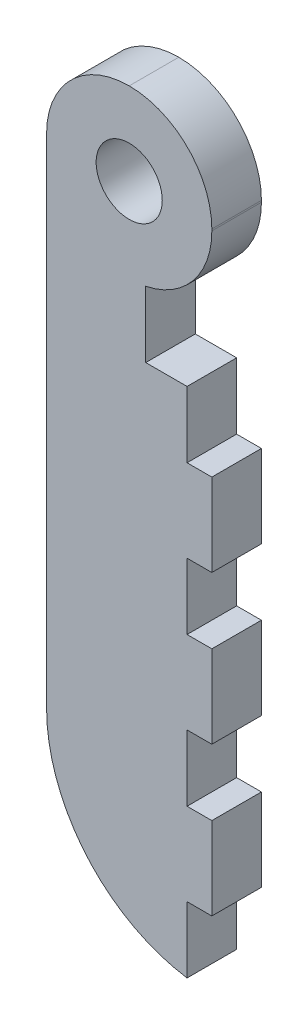
from build123d import *

# Parameters (mm, degrees)
ESQUISSE1_R             = 4
ESQUISSE1_W             = 3
ESQUISSE1_H             = 10
BOSS_EXTRU_1_DEPTH      = 6
ENL_V_MAT_EXTRU_1_DEPTH = 6
CONG_1_R                = 10
CONG_2_R                = 20


with BuildPart() as part:
    # Esquisse1 → Boss.-Extru.1 (new body)
    # profile 1 of 4: a face of its own
    with BuildSketch(Plane.XY):
        Polygon((-3, 44), (-3, 54), (-3, 62), (0, 62), (0, 90), (-20, 90), (-20, 0), (-3, 0), (-3, 8), (-3, 18), (-3, 26), (-3, 36), align=None)
        with Locations((-10, 80)):
            Circle(ESQUISSE1_R, mode=Mode.SUBTRACT)
    # profile 2 of 4: a face of its own
    with BuildSketch(Plane.XY):
        with Locations((-1.5, 49)):
            Rectangle(ESQUISSE1_W, ESQUISSE1_H)
    # profile 3 of 4: a face of its own
    with BuildSketch(Plane.XY):
        with Locations((-1.5, 31)):
            Rectangle(ESQUISSE1_W, ESQUISSE1_H)
    # profile 4 of 4: a face of its own
    with BuildSketch(Plane.XY):
        with Locations((-1.5, 13)):
            Rectangle(ESQUISSE1_W, ESQUISSE1_H)
    extrude(amount=BOSS_EXTRU_1_DEPTH)

    # Esquisse2 → Enlèv. mat.-Extru.1 (cut)
    with BuildSketch(Plane.XY.offset(6)):
        Polygon((-3, 62), (-8, 62), (-8, 70), (0, 70), (0, 62), align=None)
    extrude(amount=-ENL_V_MAT_EXTRU_1_DEPTH, mode=Mode.SUBTRACT)

    # Congé1
    # the kernel refuses this fillet: 10 mm, written as the material it takes off along each edge
    with BuildSketch(Plane(origin=(-20, 90, -25), x_dir=(0, -1, 0), z_dir=(0, 0, 1)), Plane(origin=(0, 90, -25), x_dir=(-1, 0, 0), z_dir=(0, 0, 1))) as cong_1_piece_1:
        with BuildLine():
            CenterArc((CONG_1_R, CONG_1_R), CONG_1_R, 180, 90)
            Line((0, CONG_1_R), (-CONG_1_R * 0.02, CONG_1_R))
            Line((-CONG_1_R * 0.02, CONG_1_R), (-CONG_1_R * 0.02, -CONG_1_R * 0.02))
            Line((-CONG_1_R * 0.02, -CONG_1_R * 0.02), (CONG_1_R, -CONG_1_R * 0.02))
            Line((CONG_1_R, -CONG_1_R * 0.02), (CONG_1_R, 0))
        make_face()
    extrude(amount=56, mode=Mode.SUBTRACT)
    with BuildSketch(Plane(origin=(0, 70, 30.494897428), x_dir=(0, 1, 0), z_dir=(0, 0, -1))) as cong_1_piece_2:
        with BuildLine():
            CenterArc((9.797958971, -10), CONG_1_R, 90, 78.463040967)
            Line((0, -8), (-0.195959179, -7.96))
            ThreePointArc((-0.195959179, -7.96), (-0.2, -4), (-0.2, 0))
            Line((-0.2, 0), (0, 0.2))
            Line((0, 0.2), (9.797958971, 0.2))
            Line((9.797958971, 0.2), (9.797958971, 0))
        make_face()
    extrude(amount=54.989794856, mode=Mode.SUBTRACT)

    # Congé2
    # the kernel refuses this fillet: 20 mm, written as the material it takes off along each edge
    with BuildSketch(Plane(origin=(-20, 0, -49.434299833), x_dir=(1, 0, 0), z_dir=(0, 0, 1))) as cong_2_piece_1:
        with BuildLine():
            CenterArc((20, 19.773719933), CONG_2_R, 180, 81.373073441)
            Line((0, 19.773719933), (-0.4, 19.773719933))
            Line((-0.4, 19.773719933), (-0.4, 0))
            Line((-0.4, 0), (0, -0.4))
            ThreePointArc((0, -0.4), (8.5, -0.4), (16.94, -0.395474399))
            Line((16.94, -0.395474399), (17, 0))
        make_face()
    extrude(amount=104.868599666, mode=Mode.SUBTRACT)


solid = part.part
